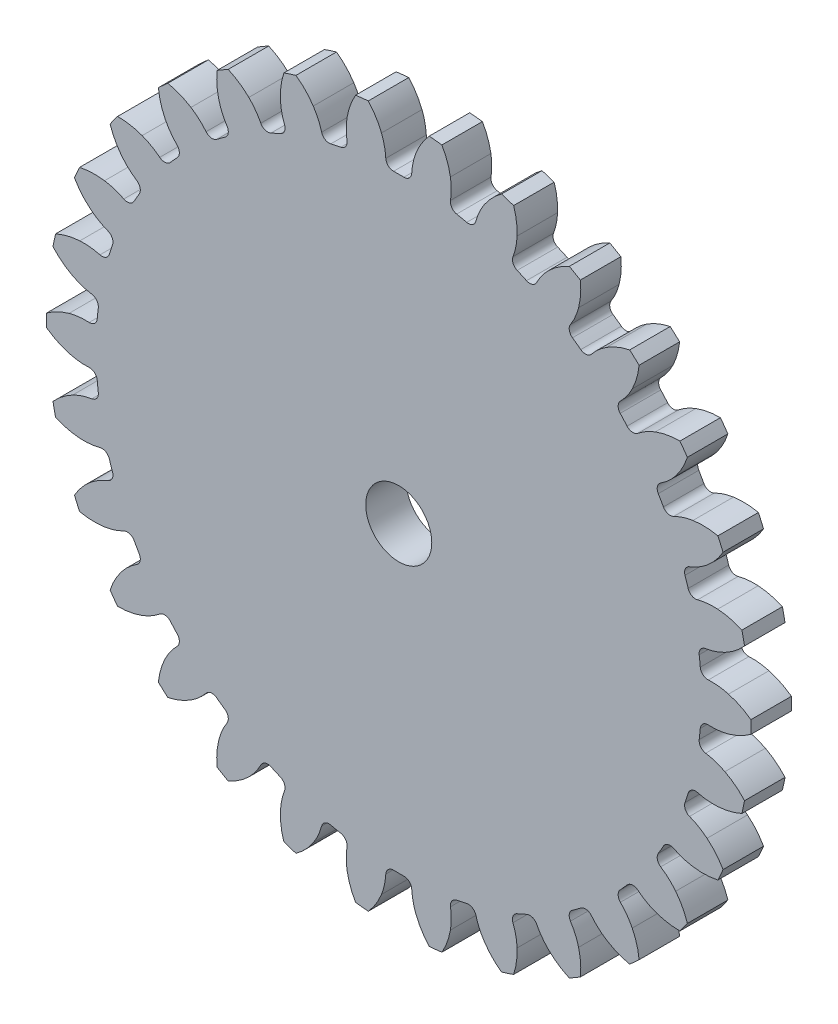
from build123d import *

# Parameters (mm, degrees)
SKETCH1_R        = 50.8
GEAR_BASE_DEPTH  = 2.921
GEAR_CUT_DEPTH   = 73.079185373
GEAR_TEETH_COUNT = 30
SKETCH3_R        = 4.7625
BORE_DEPTH       = 72.944977264


with BuildPart() as part:
    # Sketch1 → GEAR_BASE (new, symmetric)
    with BuildSketch(Plane.XY):
        Circle(SKETCH1_R)
    extrude(amount=GEAR_BASE_DEPTH, both=True)

    # Sketch2 → GEAR_CUT (cut, through all)
    with BuildSketch(Plane.XY.offset(2.921)):
        with BuildLine():
            ThreePointArc((-49.872591357, -9.662537522), (-50.521712285, -5.310045934), (-50.791710092, -0.917706901))
            ThreePointArc((-50.791710092, -0.917706901), (-49.247291805, -1.852666983), (-47.559654919, -2.4939625))
            ThreePointArc((-47.559654919, -2.4939625), (-46.120309896, -2.772253488), (-44.654879163, -2.813152568))
            ThreePointArc((-44.654879163, -2.813152568), (-43.86698879, -3.08349419), (-43.488323172, -3.825429621))
            ThreePointArc((-43.488323172, -3.825429621), (-43.417096495, -4.563320725), (-43.333350511, -5.299895996))
            ThreePointArc((-43.333350511, -5.299895996), (-43.549484327, -6.104347366), (-44.263950221, -6.532592995))
            ThreePointArc((-44.263950221, -6.532592995), (-45.68885438, -6.877278514), (-47.038886311, -7.448744833))
            ThreePointArc((-47.038886311, -7.448744833), (-48.556311447, -8.426905943), (-49.872591357, -9.662537522))
        make_face()
    gear_cut = extrude(amount=-GEAR_CUT_DEPTH, mode=Mode.SUBTRACT)

    # GEAR_TEETH: GEAR_CUT ×30 about axis
    gear_teeth_axis = Axis((0, 0, -3.2131), (0, 0, 1))
    for i in range(1, GEAR_TEETH_COUNT):
        add(gear_cut.rotate(gear_teeth_axis, i * 360 / GEAR_TEETH_COUNT), mode=Mode.SUBTRACT)

    # Sketch3 → BORE (cut, through all)
    with BuildSketch(Plane.XY.offset(2.921)):
        Circle(SKETCH3_R)
    extrude(amount=-BORE_DEPTH, mode=Mode.SUBTRACT)


solid = part.part
